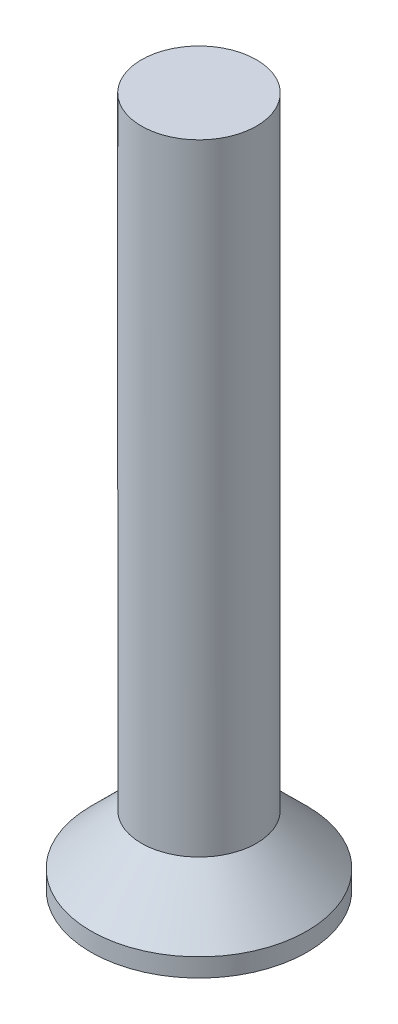
from build123d import *

# Parameters (mm, degrees)
SKETCH1_R           = 2.35
BOSS_EXTRUDE1_DEPTH = 1.5
SKETCH2_R           = 1.25
BOSS_EXTRUDE2_DEPTH = 15
CHAMFER1_SIZE       = 1.1
CUT_EXTRUDE1_DEPTH  = 0.3


with BuildPart() as part:
    # Sketch1 → Boss-Extrude1 (new body)
    with BuildSketch(Plane(origin=(0, 0, 0), x_dir=(1, 0, 0), z_dir=(0, 1, 0))):
        with Locations(Location((0, 0, 0), (0, 0, 270))):
            Circle(SKETCH1_R)
    extrude(amount=BOSS_EXTRUDE1_DEPTH)

    # Sketch2 → Boss-Extrude2 (add)
    with BuildSketch(Plane.XZ):
        with Locations(Location((0, 0, 0), (0, 0, 270))):
            Circle(SKETCH2_R)
    extrude(amount=-BOSS_EXTRUDE2_DEPTH)

    # Chamfer1
    chamfer1_edges = [part.edges().sort_by_distance(p)[0] for p in [
        (0, 1.5, -2.35),
    ]]
    chamfer(chamfer1_edges, length=CHAMFER1_SIZE - 0.0001)  # a hair under: the kernel refuses the full size

    # Sketch3 → Cut-Extrude1 (cut)
    with BuildSketch(Plane.XZ):
        Polygon((-0.25, 1.5), (-0.25, 0.25), (-1.5, 0.25), (-1.5, -0.25), (-0.25, -0.25), (-0.25, -1.5), (0.25, -1.5), (0.25, -0.25), (1.5, -0.25), (1.5, 0.25), (0.25, 0.25), (0.25, 1.5), align=None)
    extrude(amount=-CUT_EXTRUDE1_DEPTH, mode=Mode.SUBTRACT)


solid = part.part
